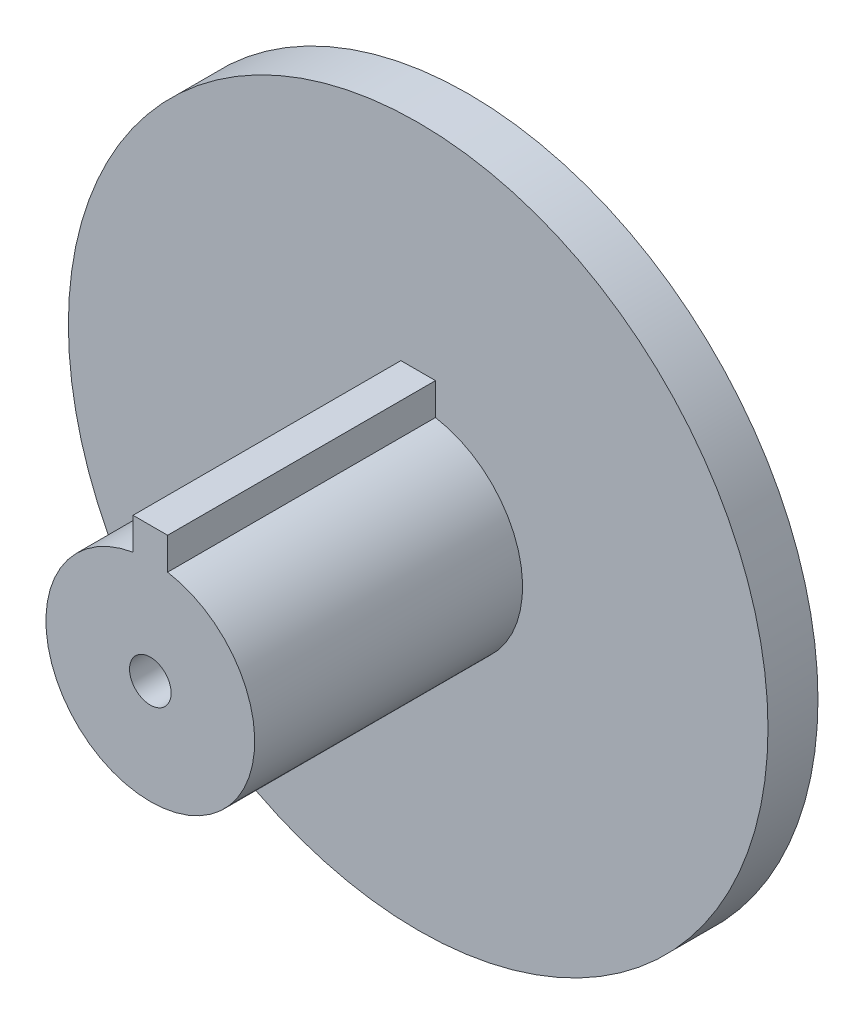
from build123d import *

# Parameters (mm, degrees)
SKETCH1_R           = 44.45
BOSS_EXTRUDE1_DEPTH = 6.35
BOSS_EXTRUDE4_DEPTH = 34.036
SKETCH3_R           = 2.6416
CUT_EXTRUDE1_DEPTH  = 75.717026145


with BuildPart() as part:
    # Sketch1 → Boss-Extrude1 (new body)
    with BuildSketch(Plane.XY):
        Circle(SKETCH1_R)
    extrude(amount=BOSS_EXTRUDE1_DEPTH)

    # Sketch2 → Boss-Extrude4 (add)
    with BuildSketch(Plane.XY.offset(6.35)):
        with BuildLine():
            Line((2.1971, 17.145), (-2.1971, 17.145))
            Line((-2.1971, 17.145), (-2.1971, 13.081))
            ThreePointArc((-2.1971, 13.081), (0, -13.264230449), (2.1971, 13.081))
            Line((2.1971, 13.081), (2.1971, 17.145))
        make_face()
    extrude(amount=BOSS_EXTRUDE4_DEPTH)

    # Sketch3 → Cut-Extrude1 (cut, through all)
    with BuildSketch(Plane(origin=(0, 0, 0), x_dir=(-1, 0, 0), z_dir=(0, 0, -1))):
        Circle(SKETCH3_R)
    extrude(amount=-CUT_EXTRUDE1_DEPTH, mode=Mode.SUBTRACT)


solid = part.part
